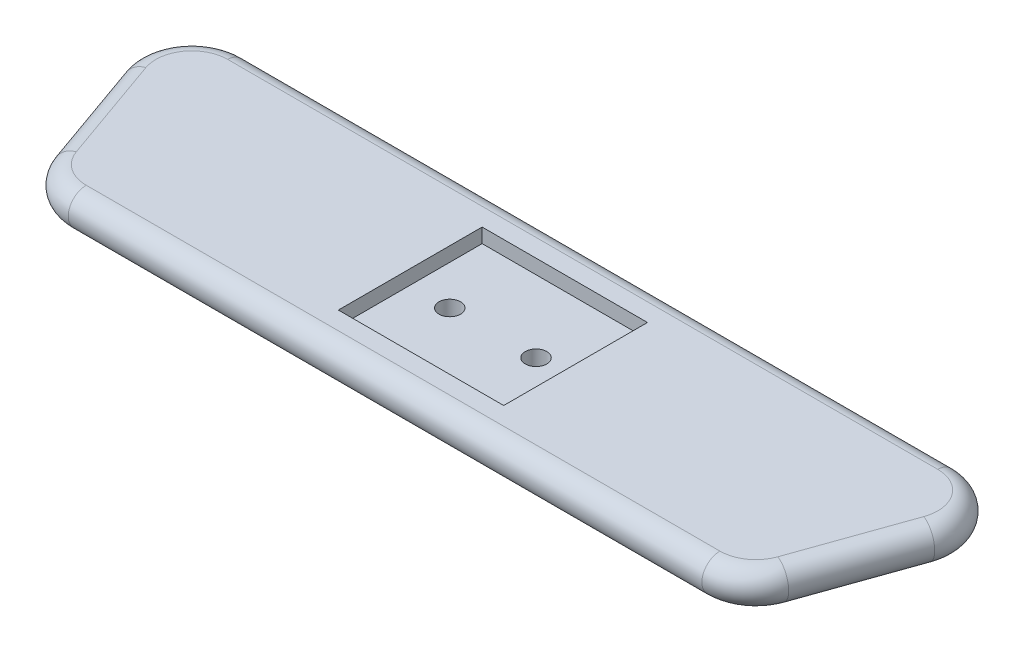
from build123d import *

# Parameters (mm, degrees)
BOSS_EXTRUDE2_DEPTH = 10
FILLET2_R           = 5
SKETCH3_W           = 46
SKETCH3_H           = 40
CUT_EXTRUDE1_DEPTH  = 4
SKETCH4_R           = 3
CUT_EXTRUDE2_DEPTH  = 6
CUT_EXTRUDE3_START  = -2
SKETCH5_R           = 2
CUT_EXTRUDE3_DEPTH  = 8


with BuildPart() as part:
    # Sketch1 → Boss-Extrude2 (new body)
    with BuildSketch(Plane(origin=(0, 0, 0), x_dir=(1, 0, 0), z_dir=(0, 1, 0))):
        with BuildLine():
            Line((-112.915113285, 9.992897111), (-102.291556109, -20.007102889))
            ThreePointArc((-102.291556109, -20.007102889), (-96.809111593, -27.249623327), (-88.151933742, -30))
            Line((-88.151933742, -30), (88.151933742, -30))
            ThreePointArc((88.151933742, -30), (96.809111593, -27.249623327), (102.291556109, -20.007102889))
            Line((102.291556109, -20.007102889), (112.915113285, 9.992897111))
            ThreePointArc((112.915113285, 9.992897111), (111.025114246, 23.657177851), (98.775490918, 30))
            Line((98.775490918, 30), (-98.775490918, 30))
            ThreePointArc((-98.775490918, 30), (-111.025114246, 23.657177851), (-112.915113285, 9.992897111))
        make_face()
    extrude(amount=BOSS_EXTRUDE2_DEPTH)

    # Fillet2
    fillet2_edges = [part.edges().sort_by_distance(p)[0] for p in [
        (111.025114246, 10, -23.657177851),
        (0, 0, -30),
        (-111.025114246, 0, -23.657177851),
        (107.603334697, 10, 5.007102889),
        (96.809111593, 10, 27.249623327),
        (0, 10, 30),
        (-96.809111593, 10, 27.249623327),
        (-107.603334697, 10, 5.007102889),
        (0, 10, -30),
        (-107.603334697, 0, 5.007102889),
        (0, 0, 30),
        (107.603334697, 0, 5.007102889),
    ]]
    fillet(fillet2_edges, radius=FILLET2_R - 0.0001)  # a hair under: the kernel refuses the full size

    # Sketch3 → Cut-Extrude1 (cut)
    with BuildSketch(Plane(origin=(0, 10, 0), x_dir=(1, 0, 0), z_dir=(0, 1, 0))):
        Rectangle(SKETCH3_W, SKETCH3_H)
    extrude(amount=-CUT_EXTRUDE1_DEPTH, mode=Mode.SUBTRACT)

    # Sketch4 → Cut-Extrude2 (cut)
    with BuildSketch(Plane(origin=(0, 6, 0), x_dir=(1, 0, 0), z_dir=(0, 1, 0))):
        with Locations(Location((12, 0, 0), (0, 0, 270))):
            Circle(SKETCH4_R)
        with Locations(Location((-12, 0, 0), (0, 0, 90))):
            Circle(SKETCH4_R)
    extrude(amount=-CUT_EXTRUDE2_DEPTH, mode=Mode.SUBTRACT)

    # Sketch5 → Cut-Extrude3 (cut)
    with BuildSketch(Plane(origin=(0, 10, 0), x_dir=(1, 0, 0), z_dir=(0, 1, 0)).offset(CUT_EXTRUDE3_START)):
        with Locations(Location((-70, 8, 0), (0, 0, 270))):
            Circle(SKETCH5_R)
        with Locations(Location((-70, -8, 0), (0, 0, 90))):
            Circle(SKETCH5_R)
        with Locations(Location((70, -8, 0), (0, 0, 270))):
            Circle(SKETCH5_R)
        with Locations(Location((70, 8, 0), (0, 0, 90))):
            Circle(SKETCH5_R)
    extrude(amount=-CUT_EXTRUDE3_DEPTH, mode=Mode.SUBTRACT)


solid = part.part
